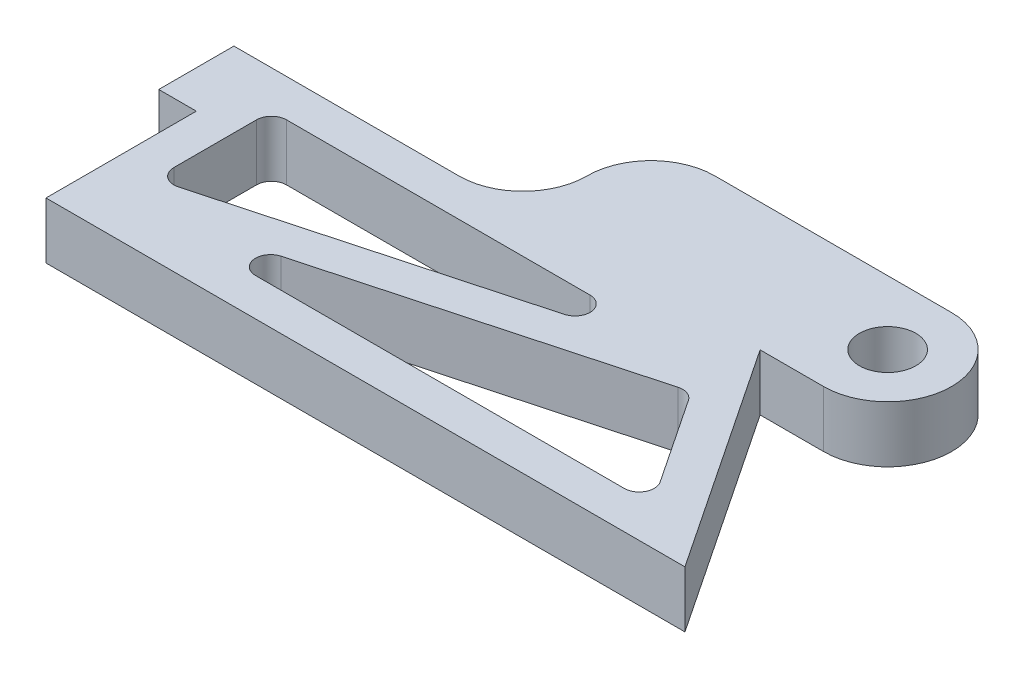
from build123d import *

# Parameters (mm, degrees)
SKETCH1_R           = 4.7625
BOSS_EXTRUDE1_DEPTH = 9.525
FILLET6_R           = 2.54


with BuildPart() as part:
    # Sketch1 → Boss-Extrude1 (new body)
    with BuildSketch(Plane(origin=(0, 0, 0), x_dir=(1, 0, 0), z_dir=(0, 1, 0))):
        with BuildLine():
            Line((0, 0), (38.033922018, 0))
            ThreePointArc((38.033922018, 0), (45.667139721, 3.161782297), (48.828922018, 10.795))
            Line((48.828922018, 10.795), (48.828922018, 10.836986448))
            ThreePointArc((48.828922018, 10.836986448), (51.990704315, 18.470204151), (59.623922018, 21.631986448))
            Line((59.623922018, 21.631986448), (99.628922018, 21.631986448))
            ThreePointArc((99.628922018, 21.631986448), (110.444915242, 10.815993224), (99.628922018, 0))
            Line((99.628922018, 0), (88.9, 0))
            Line((88.9, 0), (114.3, -38.1))
            Line((114.3, -38.1), (6.35, -38.1))
            Line((6.35, -38.1), (6.35, -12.7))
            Line((6.35, -12.7), (0, -12.7))
            Line((0, -12.7), (0, 0))
        make_face()
        with Locations((99.628922018, 10.815993224)):
            Circle(SKETCH1_R, mode=Mode.SUBTRACT)
        Polygon((89.21485613, -11.919909495), (102.434916467, -31.75), (16.413272997, -31.75), align=None, mode=Mode.SUBTRACT)
        Polygon((12.7, -26.180090505), (12.7, -6.35), (85.501583134, -6.35), align=None, mode=Mode.SUBTRACT)
    extrude(amount=BOSS_EXTRUDE1_DEPTH)

    # Fillet6
    fillet6_edges = [part.edges().sort_by_distance(p)[0] for p in [
        (102.434916467, 4.7625, 31.75),
        (89.21485613, 4.7625, 11.919909495),
        (16.413272997, 4.7625, 31.75),
        (12.7, 4.7625, 26.180090505),
        (12.7, 4.7625, 6.35),
        (85.501583134, 4.7625, 6.35),
    ]]
    fillet(fillet6_edges, radius=FILLET6_R)


solid = part.part
